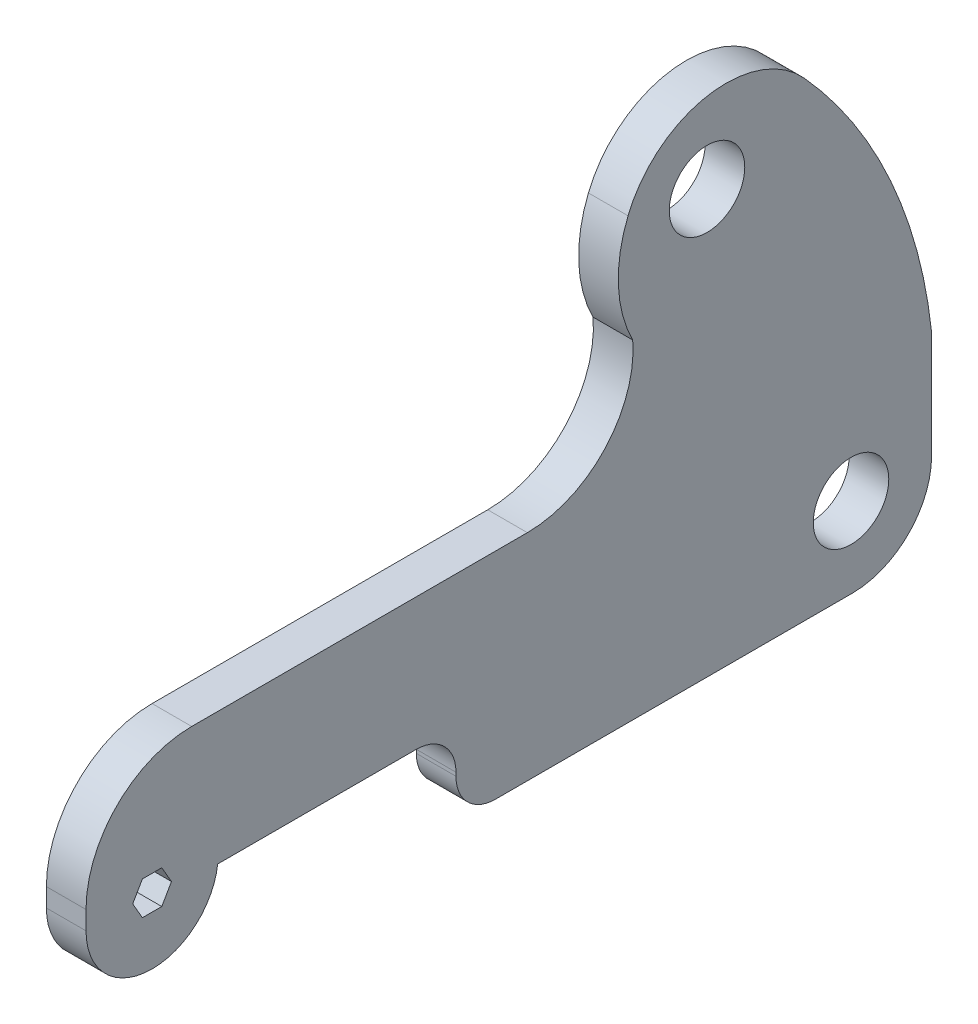
from build123d import *

# Parameters (mm, degrees)
SALIENTE_EXTRUIR1_DEPTH = 15
CORTAR_EXTRUIR1_DEPTH   = 477.91260816
REDONDEO1_R             = 220
REDONDEO2_R             = 70
REDONDEO3_R             = 15
REDONDEO4_R             = 30
CROQUIS7_R              = 14.29
CORTAR_EXTRUIR5_DEPTH   = 477.91260816
CROQUIS8_R              = 14.29
CORTAR_EXTRUIR6_DEPTH   = 523
CROQUIS9_R              = 14.289999998
CORTAR_EXTRUIR7_DEPTH   = 10
CROQUIS12_R             = 12.5
CORTAR_EXTRUIR10_DEPTH  = 10
CROQUIS13_R             = 2.02
CORTAR_EXTRUIR11_DEPTH  = 10
CORTAR_EXTRUIR12_DEPTH  = 477.91260816
REDONDEO5_R             = 40
CORTAR_EXTRUIR13_DEPTH  = 429.858749969
REDONDEO6_R             = 40


with BuildPart() as part:
    # Croquis1 → Saliente-Extruir1 (new body)
    with BuildSketch(Plane(origin=(0, 0, 0), x_dir=(0, 0, -1), z_dir=(1, 0, 0))):
        with BuildLine():
            Line((65, 25.4), (65, 281.06162282))
            Line((65, 281.06162282), (385, 281.06162282))
            Line((385, 281.06162282), (385, -8.93837718))
            Line((385, -8.93837718), (205, -8.93837718))
            Line((205, -8.93837718), (205, 22.4))
            Line((205, 22.4), (115, 22.4))
            Line((115, 22.4), (114.819347292, 22.4))
            ThreePointArc((114.819347292, 22.4), (88.497282844, 0.445204045), (65, 25.4))
        make_face()
    extrude(amount=SALIENTE_EXTRUIR1_DEPTH)

    # Croquis2 → Cortar-Extruir1 (cut, through all)
    with BuildSketch(Plane.ZY):
        Polygon((-82.667651581, 25.4), (-86.333825791, 31.75), (-93.666174209, 31.75), (-97.332348419, 25.4), (-93.666174209, 19.05), (-86.333825791, 19.05), align=None)
    extrude(amount=-CORTAR_EXTRUIR1_DEPTH, mode=Mode.SUBTRACT)

    # Redondeo1
    redondeo1_edges = [part.edges().sort_by_distance(p)[0] for p in [
        (7.5, 281.06162282, -385),
    ]]
    fillet(redondeo1_edges, radius=REDONDEO1_R)

    # Redondeo2
    redondeo2_edges = [part.edges().sort_by_distance(p)[0] for p in [
        (7.5, 281.06162282, -65),
    ]]
    fillet(redondeo2_edges, radius=REDONDEO2_R)

    # Redondeo3
    redondeo3_edges = [part.edges().sort_by_distance(p)[0] for p in [
        (7.5, -8.93837718, -205),
        (7.5, 22.4, -205),
    ]]
    fillet(redondeo3_edges, radius=REDONDEO3_R)

    # Redondeo4
    redondeo4_edges = [part.edges().sort_by_distance(p)[0] for p in [
        (7.5, -8.93837718, -385),
    ]]
    fillet(redondeo4_edges, radius=REDONDEO4_R)

    # Croquis7 → Cortar-Extruir5 (cut, through all)
    with BuildSketch(Plane(origin=(15, 0, 0), x_dir=(0, 0, -1), z_dir=(1, 0, 0))):
        with Locations((354.499999998, 21.561622823)):
            Circle(CROQUIS7_R)
    extrude(amount=-CORTAR_EXTRUIR5_DEPTH, mode=Mode.SUBTRACT)

    # Croquis8 → Cortar-Extruir6 (cut)
    with BuildSketch(Plane(origin=(15, 0, 0), x_dir=(0, 0, -1), z_dir=(1, 0, 0))):
        with Locations((299.999999998, 151.061622823)):
            Circle(CROQUIS8_R)
    extrude(amount=-CORTAR_EXTRUIR6_DEPTH, mode=Mode.SUBTRACT)

    # Croquis9 → Cortar-Extruir7 (cut)
    with BuildSketch(Plane(origin=(15, 0, 0), x_dir=(0, 0, -1), z_dir=(1, 0, 0))):
        with Locations((184.499999998, 231.061622823)):
            Circle(CROQUIS9_R)
    extrude(amount=-CORTAR_EXTRUIR7_DEPTH, mode=Mode.SUBTRACT)

    # Croquis12 → Cortar-Extruir10 (cut)
    with BuildSketch(Plane.ZY):
        with Locations((-267.424734061, 207.135375692)):
            Circle(CROQUIS12_R)
    extrude(amount=-CORTAR_EXTRUIR10_DEPTH, mode=Mode.SUBTRACT)

    # Croquis13 → Cortar-Extruir11 (cut)
    with BuildSketch(Plane.ZY):
        with Locations((-263.175315265, 232.177389187)):
            Circle(CROQUIS13_R)
        with Locations((-271.674152858, 182.093362197)):
            Circle(CROQUIS13_R)
    extrude(amount=-CORTAR_EXTRUIR11_DEPTH, mode=Mode.SUBTRACT)

    # Croquis14 → Cortar-Extruir12 (cut, through all)
    with BuildSketch(Plane(origin=(15, 0, 0), x_dir=(0, 0, -1), z_dir=(1, 0, 0))):
        with BuildLine():
            Line((65, 72.4), (270, 72.4))
            ThreePointArc((270, 72.4), (274.363902477, 93.8541681), (271.886825139, 115.607077366))
            ThreePointArc((271.886825139, 115.607077366), (293.695729554, 182.870527235), (360.959179423, 161.06162282))
            Line((360.959179423, 161.06162282), (409.037931036, 257.33581614))
            Line((409.037931036, 257.33581614), (105.335360325, 302.08857435))
            Line((105.335360325, 302.08857435), (0, 212.58305793))
            Line((0, 212.58305793), (65, 72.4))
        make_face()
    extrude(amount=-CORTAR_EXTRUIR12_DEPTH, mode=Mode.SUBTRACT)

    # Redondeo5
    # the kernel refuses this fillet: 40 mm, written as the material it adds along each edge
    with BuildSketch(Plane(origin=(15, 72.4, -270), x_dir=(0, 0.9990478553757552, -0.04362777405625806), z_dir=(-1, 0, 0))) as redondeo5_piece_1:
        with BuildLine():
            CenterArc((38.304739361, -39.69334508), REDONDEO5_R, 82.900783035, 94.598735985)
            Line((-1.657174854, -37.948234118), (0, 0))
            ThreePointArc((0, 0), (21.62412798, 3.423749812), (43.24825596, 0))
        make_face()
    extrude(amount=15)
    # the kernel refuses this fillet: 40 mm, written as the material it takes off along each edge
    with BuildSketch(Plane(origin=(115, 72.4, -65), x_dir=(0, 0, -1), z_dir=(-1, 0, 0))) as redondeo5_2_piece_1:
        with BuildLine():
            CenterArc((REDONDEO5_R, REDONDEO5_R), REDONDEO5_R, 180, 90)
            Line((0, REDONDEO5_R), (0, 0))
            Line((0, 0), (REDONDEO5_R, 0))
        make_face()
    extrude(amount=215, mode=Mode.SUBTRACT)

    # Croquis15 → Cortar-Extruir13 (cut, through all)
    with BuildSketch(Plane(origin=(15, 0, 0), x_dir=(0, 0, -1), z_dir=(1, 0, 0))):
        with BuildLine():
            Line((316.423002092, 188.334350093), (358.626196651, 190.922485321))
            Line((358.626196651, 190.922485321), (422.761195779, 101.204099428))
            Line((422.761195779, 101.204099428), (385, 21.06162282))
            ThreePointArc((385, 21.06162282), (371.881027209, 113.376882144), (316.423002092, 188.334350093))
        make_face()
    extrude(amount=-CORTAR_EXTRUIR13_DEPTH, mode=Mode.SUBTRACT)

    # Redondeo6
    # the kernel refuses this fillet: 40 mm, written as the material it takes off along each edge
    with BuildSketch(Plane(origin=(154.505258907, 188.334350093, -316.423002092), x_dir=(0, -0.5580210387586911, 0.8298268013885014), z_dir=(-1, 0, 0))) as redondeo6_piece_1:
        with BuildLine():
            CenterArc((33.481262138, -33.19307214), REDONDEO6_R, 56.080950645, 115.615192881)
            ThreePointArc((-6.099380681, -27.416159986), (-3.556977801, -13.595221761), (0, 0))
            ThreePointArc((0, 0), (27.901051781, 8.508659825), (55.802103563, 0))
        make_face()
    extrude(amount=294.010517815, mode=Mode.SUBTRACT)


solid = part.part
